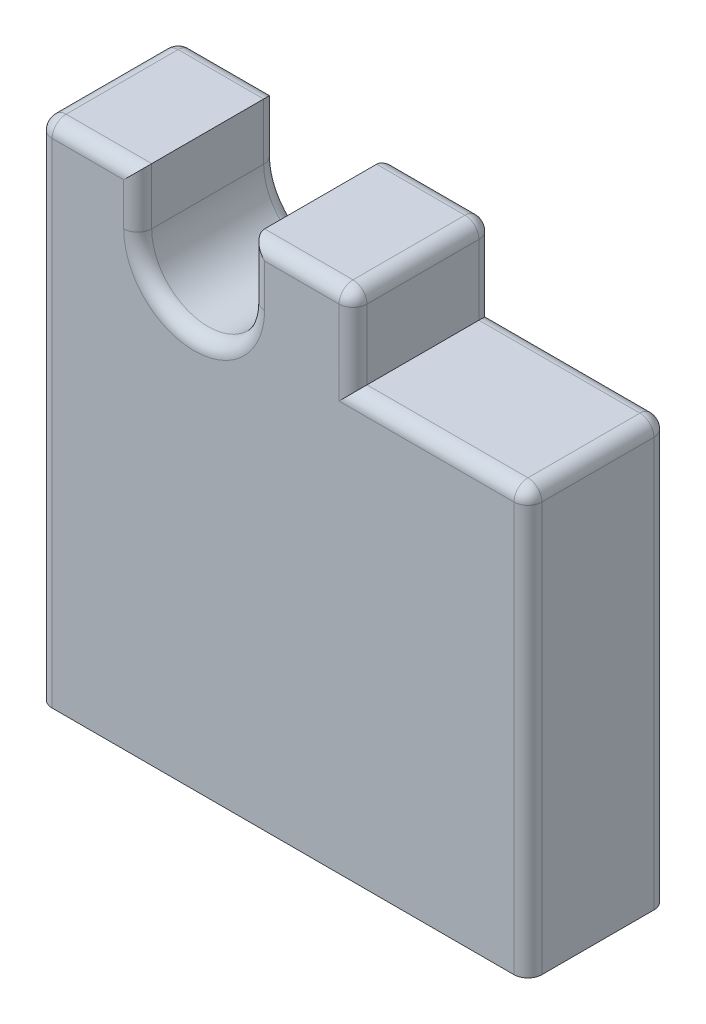
from build123d import *

# Parameters (mm, degrees)
BOSS_EXTRUDE1_DEPTH = 25.4
FILLET4_R           = 2.54
FILLET5_R           = 2.54


with BuildPart() as part:
    # Sketch2 → Boss-Extrude1 (new body)
    with BuildSketch(Plane.XY):
        with BuildLine():
            Line((0, 0), (0, 92.075))
            Line((0, 92.075), (18.075, 92.075))
            Line((18.075, 92.075), (18.075, 81.825))
            ThreePointArc((18.075, 81.825), (28.325, 71.575), (38.575, 81.825))
            Line((38.575, 81.825), (38.575, 92.075))
            Line((38.575, 92.075), (57.15, 92.075))
            Line((57.15, 92.075), (57.15, 76.835))
            Line((57.15, 76.835), (88.9, 76.835))
            Line((88.9, 76.835), (88.9, 0))
            Line((88.9, 0), (0, 0))
        make_face()
    extrude(amount=BOSS_EXTRUDE1_DEPTH)

    # Fillet4
    fillet4_edges = [part.edges().sort_by_distance(p)[0] for p in [
        (0, 46.0375, 0),
        (9.0375, 92.075, 0),
        (18.075, 86.95, 0),
        (28.325, 71.575, 0),
        (38.575, 86.95, 0),
        (47.8625, 92.075, 0),
        (57.15, 84.455, 0),
        (73.025, 76.835, 25.4),
        (73.025, 76.835, 0),
        (88.9, 38.4175, 0),
        (57.15, 84.455, 25.4),
        (88.9, 76.835, 12.7),
        (47.8625, 92.075, 25.4),
        (38.575, 86.95, 25.4),
        (28.325, 71.575, 25.4),
        (18.075, 86.95, 25.4),
        (9.0375, 92.075, 25.4),
        (0, 46.0375, 25.4),
        (88.9, 38.4175, 25.4),
    ]]
    fillet(fillet4_edges, radius=FILLET4_R)

    # Fillet5
    # the kernel refuses this fillet: 2.54 mm, written as the material it takes off along each edge
    with BuildSketch(Plane(origin=(2.54, 89.535, 22.86), x_dir=(0, 1, 0), z_dir=(-1, 0, 0))) as fillet5_piece_1_section:
        Polygon((0, 0), (FILLET5_R, 0), (FILLET5_R, -FILLET5_R), (0, -FILLET5_R), align=None)
    fillet5_piece_1 = extrude(amount=FILLET5_R, mode=Mode.PRIVATE)
    fillet5_piece_1 = fillet5_piece_1 - Plane(origin=(2.54, 89.535, 22.86), x_dir=(0, -0.7071067811865475, -0.7071067811865475), z_dir=(-1, 0, 0)) * Sphere(FILLET5_R, mode=Mode.PRIVATE)
    add(fillet5_piece_1, mode=Mode.SUBTRACT)
    with BuildSketch(Plane(origin=(54.61, 89.535, 22.86), x_dir=(0, 1, 0), z_dir=(1, 0, 0))) as fillet5_piece_2_section:
        Polygon((0, 0), (FILLET5_R, 0), (FILLET5_R, FILLET5_R), (0, FILLET5_R), align=None)
    fillet5_piece_2 = extrude(amount=FILLET5_R, mode=Mode.PRIVATE)
    fillet5_piece_2 = fillet5_piece_2 - Plane(origin=(54.61, 89.535, 22.86), x_dir=(0, -0.7071067811865475, -0.7071067811865475), z_dir=(1, 0, 0)) * Sphere(FILLET5_R, mode=Mode.PRIVATE)
    add(fillet5_piece_2, mode=Mode.SUBTRACT)
    with BuildSketch(Plane(origin=(2.54, 89.535, 2.54), x_dir=(0, 1, 0), z_dir=(-1, 0, 0))) as fillet5_piece_3_section:
        Polygon((0, 0), (FILLET5_R, 0), (FILLET5_R, FILLET5_R), (0, FILLET5_R), align=None)
    fillet5_piece_3 = extrude(amount=FILLET5_R, mode=Mode.PRIVATE)
    fillet5_piece_3 = fillet5_piece_3 - Plane(origin=(2.54, 89.535, 2.54), x_dir=(0, -0.7071067811865475, 0.7071067811865475), z_dir=(-1, 0, 0)) * Sphere(FILLET5_R, mode=Mode.PRIVATE)
    add(fillet5_piece_3, mode=Mode.SUBTRACT)
    with BuildSketch(Plane(origin=(54.61, 89.535, 2.54), x_dir=(0, 1, 0), z_dir=(1, 0, 0))) as fillet5_piece_4_section:
        Polygon((0, 0), (FILLET5_R, 0), (FILLET5_R, -FILLET5_R), (0, -FILLET5_R), align=None)
    fillet5_piece_4 = extrude(amount=FILLET5_R, mode=Mode.PRIVATE)
    fillet5_piece_4 = fillet5_piece_4 - Plane(origin=(54.61, 89.535, 2.54), x_dir=(0, -0.7071067811865475, 0.7071067811865475), z_dir=(1, 0, 0)) * Sphere(FILLET5_R, mode=Mode.PRIVATE)
    add(fillet5_piece_4, mode=Mode.SUBTRACT)
    with BuildSketch(Plane(origin=(0, 92.075, 2.54), x_dir=(0, -1, 0), z_dir=(0, 0, 1))) as fillet5_piece_5:
        with BuildLine():
            CenterArc((FILLET5_R, FILLET5_R), FILLET5_R, 180, 90)
            Line((0, FILLET5_R), (0, 0))
            Line((0, 0), (FILLET5_R, 0))
        make_face()
    extrude(amount=20.32, mode=Mode.SUBTRACT)
    with BuildSketch(Plane(origin=(57.15, 92.075, 2.54), x_dir=(0, -1, 0), z_dir=(0, 0, 1))) as fillet5_piece_6:
        with BuildLine():
            CenterArc((FILLET5_R, -FILLET5_R), FILLET5_R, 90, 90)
            Line((0, -FILLET5_R), (0, 0))
            Line((0, 0), (FILLET5_R, 0))
        make_face()
    extrude(amount=20.32, mode=Mode.SUBTRACT)


solid = part.part
